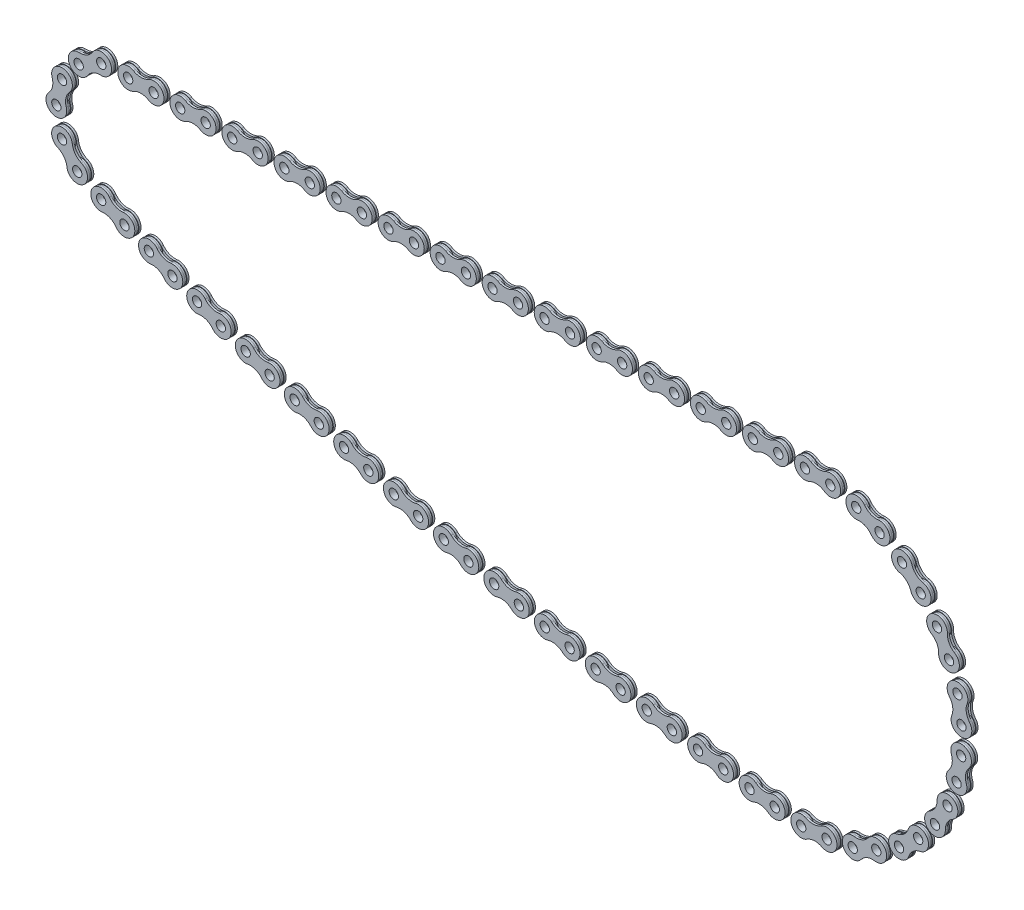
from build123d import *

# Parameters (mm, degrees)
SKETCH1_R             = 4.75
SKETCH1_R_2           = 2.25
BOSS_EXTRUDE2_DEPTH   = 1
BOSS_EXTRUDE2_2_DEPTH = 1
SKETCH2_R             = 2.25
BOSS_EXTRUDE3_DEPTH   = 0.5
CRVPATTERN1_5_ANGLE   = 4.3006626
CRVPATTERN1_6_ANGLE   = 23.4954446
CRVPATTERN1_7_ANGLE   = 42.6902266
CRVPATTERN1_8_ANGLE   = 61.8850086
CRVPATTERN1_9_ANGLE   = 81.0797905
CRVPATTERN1_10_ANGLE  = 100.2745725
CRVPATTERN1_11_ANGLE  = 119.4693545
CRVPATTERN1_12_ANGLE  = 138.6641364
CRVPATTERN1_13_ANGLE  = 157.8589184
CRVPATTERN1_14_ANGLE  = 177.0537004
CRVPATTERN1_15_ANGLE  = 172.4058142
CRVPATTERN1_16_ANGLE  = 171.1598528
CRVPATTERN1_17_ANGLE  = 169.9138915
CRVPATTERN1_18_ANGLE  = 168.6679301
CRVPATTERN1_19_ANGLE  = 167.4219688
CRVPATTERN1_20_ANGLE  = 166.1760075
CRVPATTERN1_21_ANGLE  = 164.9300461
CRVPATTERN1_22_ANGLE  = 163.6840848
CRVPATTERN1_23_ANGLE  = 162.4381235
CRVPATTERN1_24_ANGLE  = 161.1921621
CRVPATTERN1_25_ANGLE  = 159.9462008
CRVPATTERN1_26_ANGLE  = 158.7002394
CRVPATTERN1_27_ANGLE  = 157.4542781
CRVPATTERN1_28_ANGLE  = 156.2083168
CRVPATTERN1_29_ANGLE  = 126.6505574
CRVPATTERN1_30_ANGLE  = 77.1794698
CRVPATTERN1_31_ANGLE  = 27.7083823


with BuildPart() as part:
    # Sketch1 → Boss-Extrude2 (new, symmetric)
    with BuildSketch(Plane.XY):
        with Locations((-6.15, 0)):
            Circle(SKETCH1_R)
        with Locations((-6.15, 0)):
            Circle(SKETCH1_R_2, mode=Mode.SUBTRACT)
    extrude(amount=BOSS_EXTRUDE2_DEPTH, both=True)



with BuildPart() as body_2:
    # Sketch1 → Boss-Extrude2 2 (new, symmetric)
    with BuildSketch(Plane.XY):
        with Locations(Location((6.15, 0, 0), (0, 0, 180))):
            Circle(SKETCH1_R)
        with Locations(Location((6.15, 0, 0), (0, 0, 180))):
            Circle(SKETCH1_R_2, mode=Mode.SUBTRACT)
    extrude(amount=BOSS_EXTRUDE2_2_DEPTH, both=True)


with BuildPart() as part_1:
    add(part.part)

    add(body_2.part)  # Boss-Extrude3 merges body 2
    # Sketch2 → Boss-Extrude3 (add, symmetric)
    with BuildSketch(Plane.XY.offset(1)):
        with BuildLine():
            ThreePointArc((-3.624873825, 4.315522888), (-11.149999319, 0.002609948), (-3.629380516, -4.318156715))
            ThreePointArc((-3.629380516, -4.318156715), (0, -3.336386658), (3.629380516, -4.318156715))
            ThreePointArc((3.629380516, -4.318156715), (11.149999319, 0.002609948), (3.624873825, 4.315522888))
            ThreePointArc((3.624873825, 4.315522888), (0, 3.332941031), (-3.624873825, 4.315522888))
        make_face()
        with Locations(Location((6.15, 0, 0), (0, 0, 180))):
            Circle(SKETCH2_R, mode=Mode.SUBTRACT)
        with Locations((-6.15, 0)):
            Circle(SKETCH2_R, mode=Mode.SUBTRACT)
    boss_extrude3 = extrude(amount=BOSS_EXTRUDE3_DEPTH, both=True)

    # Mirror1: Boss-Extrude3 across plane
    add(boss_extrude3.mirror(Plane.XY))


with BuildPart() as body_2_2:
    # CrvPattern1: read off the stored shape, not the designer's step
    # CrvPattern1: copy of part
    add(part_1.part.moved(Location((25.1259108, 0, 0))))


with BuildPart() as body_3:
    # CrvPattern1 2: copy of part
    add(part_1.part.moved(Location((50.2518217, 0, 0))))


with BuildPart() as body_4:
    # CrvPattern1 3: copy of part
    add(part_1.part.moved(Location((75.3777325, 0, 0))))


with BuildPart() as body_5:
    # CrvPattern1 4: copy of part
    add(part_1.part.moved(Location((100.5036434, 0, 0))))


with BuildPart() as body_6:
    # CrvPattern1 5: copy of part
    add(part_1.part.moved(Location((125.2864126, 9.2100123, 0))).rotate(Axis((0, 0, 0), (0, 0, -1)), CRVPATTERN1_5_ANGLE))


with BuildPart() as body_7:
    # CrvPattern1 6: copy of part
    add(part_1.part.moved(Location((139.9518904, 54.05929, 0))).rotate(Axis((0, 0, 0), (0, 0, -1)), CRVPATTERN1_6_ANGLE))


with BuildPart() as body_8:
    # CrvPattern1 7: copy of part
    add(part_1.part.moved(Location((139.0564861, 101.2369564, 0))).rotate(Axis((0, 0, 0), (0, 0, -1)), CRVPATTERN1_7_ANGLE))


with BuildPart() as body_9:
    # CrvPattern1 8: copy of part
    add(part_1.part.moved(Location((122.6997574, 145.4974509, 0))).rotate(Axis((0, 0, 0), (0, 0, -1)), CRVPATTERN1_8_ANGLE))


with BuildPart() as body_10:
    # CrvPattern1 9: copy of part
    add(part_1.part.moved(Location((92.7003657, 181.9195657, 0))).rotate(Axis((0, 0, 0), (0, 0, -1)), CRVPATTERN1_9_ANGLE))


with BuildPart() as body_11:
    # CrvPattern1 10: copy of part
    add(part_1.part.moved(Location((52.3938645, 206.4536219, 0))).rotate(Axis((0, 0, 0), (0, 0, -1)), CRVPATTERN1_10_ANGLE))


with BuildPart() as body_12:
    # CrvPattern1 11: copy of part
    add(part_1.part.moved(Location((6.2618275, 216.3717423, 0))).rotate(Axis((0, 0, 0), (0, 0, -1)), CRVPATTERN1_11_ANGLE))


with BuildPart() as body_13:
    # CrvPattern1 12: copy of part
    add(part_1.part.moved(Location((-40.5664456, 210.5711572, 0))).rotate(Axis((0, 0, 0), (0, 0, -1)), CRVPATTERN1_12_ANGLE))


with BuildPart() as body_14:
    # CrvPattern1 13: copy of part
    add(part_1.part.moved(Location((-82.8842424, 189.6968184, 0))).rotate(Axis((0, 0, 0), (0, 0, -1)), CRVPATTERN1_13_ANGLE))


with BuildPart() as body_15:
    # CrvPattern1 14: copy of part
    add(part_1.part.moved(Location((-115.9863587, 156.0696888, 0))).rotate(Axis((0, 0, 0), (0, 0, -1)), CRVPATTERN1_14_ANGLE))


with BuildPart() as body_16:
    # CrvPattern1 15: copy of part
    add(part_1.part.moved(Location((-117.530975, 133.5436935, 0))).rotate(Axis((0, 0, 0), (0, 0, 1)), CRVPATTERN1_15_ANGLE))


with BuildPart() as body_17:
    # CrvPattern1 16: copy of part
    add(part_1.part.moved(Location((-95.283076, 131.2296615, 0))).rotate(Axis((0, 0, 0), (0, 0, 1)), CRVPATTERN1_16_ANGLE))


with BuildPart() as body_18:
    # CrvPattern1 17: copy of part
    add(part_1.part.moved(Location((-72.9901199, 129.3999442, 0))).rotate(Axis((0, 0, 0), (0, 0, 1)), CRVPATTERN1_17_ANGLE))


with BuildPart() as body_19:
    # CrvPattern1 18: copy of part
    add(part_1.part.moved(Location((-50.6626486, 128.0554068, 0))).rotate(Axis((0, 0, 0), (0, 0, 1)), CRVPATTERN1_18_ANGLE))


with BuildPart() as body_20:
    # CrvPattern1 19: copy of part
    add(part_1.part.moved(Location((-28.3112201, 127.196685, 0))).rotate(Axis((0, 0, 0), (0, 0, 1)), CRVPATTERN1_19_ANGLE))


with BuildPart() as body_21:
    # CrvPattern1 20: copy of part
    add(part_1.part.moved(Location((-5.946404, 126.824185, 0))).rotate(Axis((0, 0, 0), (0, 0, 1)), CRVPATTERN1_20_ANGLE))


with BuildPart() as body_22:
    # CrvPattern1 21: copy of part
    add(part_1.part.moved(Location((16.421224, 126.9380829, 0))).rotate(Axis((0, 0, 0), (0, 0, 1)), CRVPATTERN1_21_ANGLE))


with BuildPart() as body_23:
    # CrvPattern1 22: copy of part
    add(part_1.part.moved(Location((38.7810868, 127.5383248, 0))).rotate(Axis((0, 0, 0), (0, 0, 1)), CRVPATTERN1_22_ANGLE))


with BuildPart() as body_24:
    # CrvPattern1 23: copy of part
    add(part_1.part.moved(Location((61.122611, 128.6246269, 0))).rotate(Axis((0, 0, 0), (0, 0, 1)), CRVPATTERN1_23_ANGLE))


with BuildPart() as body_25:
    # CrvPattern1 24: copy of part
    add(part_1.part.moved(Location((83.4352318, 130.1964755, 0))).rotate(Axis((0, 0, 0), (0, 0, 1)), CRVPATTERN1_24_ANGLE))


with BuildPart() as body_26:
    # CrvPattern1 25: copy of part
    add(part_1.part.moved(Location((105.7083982, 132.2531273, 0))).rotate(Axis((0, 0, 0), (0, 0, 1)), CRVPATTERN1_25_ANGLE))


with BuildPart() as body_27:
    # CrvPattern1 26: copy of part
    add(part_1.part.moved(Location((127.9315776, 134.7936098, 0))).rotate(Axis((0, 0, 0), (0, 0, 1)), CRVPATTERN1_26_ANGLE))


with BuildPart() as body_28:
    # CrvPattern1 27: copy of part
    add(part_1.part.moved(Location((150.0942614, 137.8167216, 0))).rotate(Axis((0, 0, 0), (0, 0, 1)), CRVPATTERN1_27_ANGLE))


with BuildPart() as body_29:
    # CrvPattern1 28: copy of part
    add(part_1.part.moved(Location((172.1859692, 141.3210332, 0))).rotate(Axis((0, 0, 0), (0, 0, 1)), CRVPATTERN1_28_ANGLE))


with BuildPart() as body_30:
    # CrvPattern1 29: copy of part
    add(part_1.part.moved(Location((103.2388353, 216.6055503, 0))).rotate(Axis((0, 0, 0), (0, 0, 1)), CRVPATTERN1_29_ANGLE))


with BuildPart() as body_31:
    # CrvPattern1 30: copy of part
    add(part_1.part.moved(Location((-75.4306891, 229.4167749, 0))).rotate(Axis((0, 0, 0), (0, 0, 1)), CRVPATTERN1_30_ANGLE))


with BuildPart() as body_32:
    # CrvPattern1 31: copy of part
    add(part_1.part.moved(Location((-201.2733382, 101.9391136, 0))).rotate(Axis((0, 0, 0), (0, 0, 1)), CRVPATTERN1_31_ANGLE))


with BuildPart() as body_33:
    # CrvPattern1 32: copy of part
    add(part_1.part.moved(Location((-201.0072868, 0, 0))))


with BuildPart() as body_34:
    # CrvPattern1 33: copy of part
    add(part_1.part.moved(Location((-175.8813759, 0, 0))))


with BuildPart() as body_35:
    # CrvPattern1 34: copy of part
    add(part_1.part.moved(Location((-150.7554651, 0, 0))))


with BuildPart() as body_36:
    # CrvPattern1 35: copy of part
    add(part_1.part.moved(Location((-125.6295542, 0, 0))))


with BuildPart() as body_37:
    # CrvPattern1 36: copy of part
    add(part_1.part.moved(Location((-100.5036434, 0, 0))))


with BuildPart() as body_38:
    # CrvPattern1 37: copy of part
    add(part_1.part.moved(Location((-75.3777325, 0, 0))))


with BuildPart() as body_39:
    # CrvPattern1 38: copy of part
    add(part_1.part.moved(Location((-50.2518217, 0, 0))))


with BuildPart() as body_40:
    # CrvPattern1 39: copy of part
    add(part_1.part.moved(Location((-25.1259108, 0, 0))))


solid = Compound([part_1.part, body_2_2.part, body_3.part, body_4.part, body_5.part, body_6.part, body_7.part, body_8.part, body_9.part, body_10.part, body_11.part, body_12.part, body_13.part, body_14.part, body_15.part, body_16.part, body_17.part, body_18.part, body_19.part, body_20.part, body_21.part, body_22.part, body_23.part, body_24.part, body_25.part, body_26.part, body_27.part, body_28.part, body_29.part, body_30.part, body_31.part, body_32.part, body_33.part, body_34.part, body_35.part, body_36.part, body_37.part, body_38.part, body_39.part, body_40.part])
